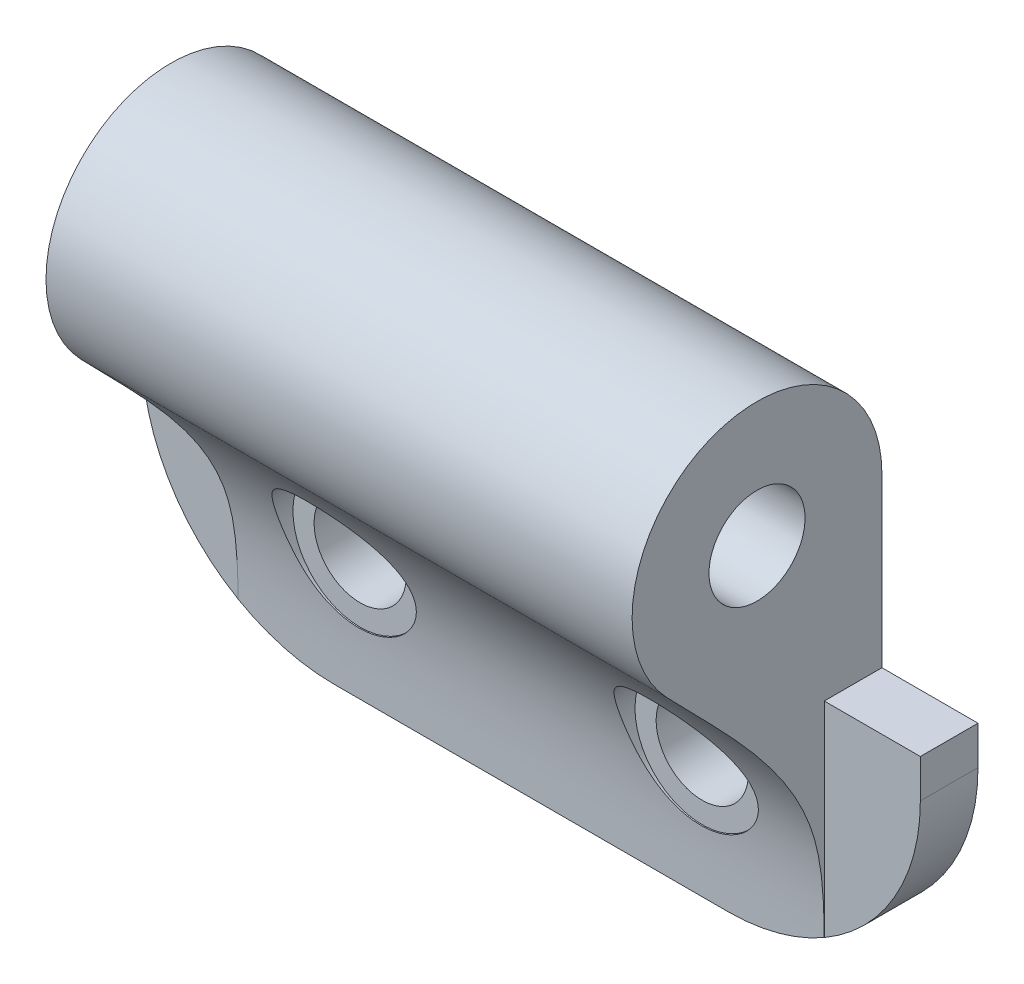
from build123d import *

# Parameters (mm, degrees)
SKETCH_1_W          = 40.5
SKETCH_1_H          = 12
EXTRUDE_1_DEPTH     = 3
SKETCH_2_R          = 2.5
EXTRUDE_2_DEPTH     = 15.25
SKETCH_3_R          = 2.4
CUT_EXTRUDE_1_DEPTH = 30.5
FILLET_1_R          = 10
SKETCH_4_R          = 3.5
CUT_EXTRUDE_2_DEPTH = 30.5


with BuildPart() as part:
    # 草图1 → 凸台-拉伸1 (new body)
    with BuildSketch(Plane.XY):
        Rectangle(SKETCH_1_W, SKETCH_1_H)
    extrude(amount=EXTRUDE_1_DEPTH)

    # 草图2 → 凸台-拉伸2 (add, symmetric)
    with BuildSketch(Plane(origin=(0, 0, 0), x_dir=(0, 0, -1), z_dir=(1, 0, 0))):
        with BuildLine():
            Line((0, -6), (0, 14.75))
            ThreePointArc((0, 14.75), (-8.92202564, 20.78189786), (-11.195012861, 10.25479653))
            add(Edge.make_bspline(
                [(-3, -6), (-3, -3.834699913), (-2.949171736, 2.430786436), (-8.113125227, 7.035920639), (-11.195012861, 10.25479653)],
                knots=[0, 0, 0, 0, 0.319547367, 1, 1, 1, 1], degree=3))
            Line((-3, -6), (0, -6))
        make_face()
        with Locations(Location((-6.5, 14.75, 0), (0, 0, 180))):
            Circle(SKETCH_2_R, mode=Mode.SUBTRACT)
    extrude(amount=EXTRUDE_2_DEPTH, both=True)

    # 草图3 → 切除-拉伸1 (cut)
    with BuildSketch(Plane(origin=(0, 0, 0), x_dir=(-1, 0, 0), z_dir=(0, 0, -1))):
        with Locations((-8.9, 0.75)):
            Circle(SKETCH_3_R)
    cut_extrude_1 = extrude(amount=-CUT_EXTRUDE_1_DEPTH, mode=Mode.SUBTRACT)

    # 镜向1: 切除-拉伸1 across plane
    add(cut_extrude_1.mirror(Plane(origin=(0, 0, 0), x_dir=(0, 0, 1), z_dir=(1, 0, 0))), mode=Mode.SUBTRACT)

    # 圆角1
    # the kernel refuses this fillet: 10 mm, written as the material it takes off along each edge
    with BuildSketch(Plane(origin=(20.25, -6, -25), x_dir=(-1, 0, 0), z_dir=(0, 0, 1)), Plane(origin=(-20.25, -6, -25), x_dir=(0, 1, 0), z_dir=(0, 0, 1))) as fillet_1_piece_1:
        with BuildLine():
            CenterArc((FILLET_1_R, -FILLET_1_R), FILLET_1_R, 90, 90)
            Line((0, -FILLET_1_R), (0, 0))
            Line((0, 0), (FILLET_1_R, 0))
        make_face()
    extrude(amount=53, mode=Mode.SUBTRACT)

    # 草图4 → 切除-拉伸2 (cut)
    with BuildSketch(Plane.XY.offset(3)):
        with Locations(Location((-8.9, 0.75, 0), (0, 0, 180))):
            Circle(SKETCH_4_R)
    cut_extrude_2 = extrude(amount=CUT_EXTRUDE_2_DEPTH, mode=Mode.SUBTRACT)

    # 镜向2: 切除-拉伸2 across plane
    add(cut_extrude_2.mirror(Plane(origin=(0, 0, 0), x_dir=(0, 0, 1), z_dir=(1, 0, 0))), mode=Mode.SUBTRACT)


solid = part.part
